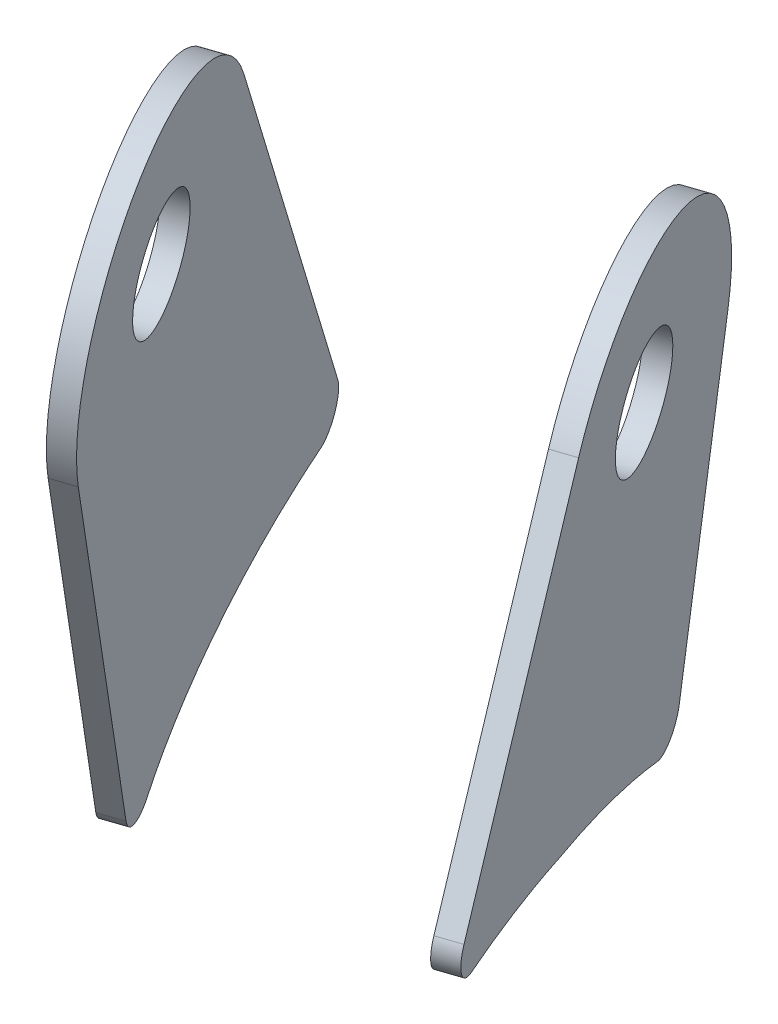
from build123d import *

# Parameters (mm, degrees)
SKETCH2_R            = 3.175
BASE_FLANGE1_DEPTH   = 1.27
BASE_FLANGE2_START   = -1.27
SKETCH3_R            = 3.175
BASE_FLANGE2_DEPTH   = 1.27
CUT_EXTRUDE1_START   = 1383.390590681
CUT_EXTRUDE1_DEPTH   = 21.59
CUT_EXTRUDE1_START_2 = 1403.710590681
CUT_EXTRUDE1_2_DEPTH = 1.27
FILLET1_R            = 1.5875
FILLET2_R            = 1.5875


# Read off the part's stored shape, not the designer's step: Cut-Extrude1
# Sheet-metal steps are written as plain solids
with BuildPart() as part:
    # Sketch2 → Base-Flange1 (new body)
    with BuildSketch(Plane(origin=(1271.017200109, -117.186128876, -584.111385454), x_dir=(-0.41343144837747287, 0.048074727094114526, -0.9092652297912482), z_dir=(0.9054695523042622, -0.08348311229805495, -0.4161195258708122))):
        with BuildLine():
            Line((-111.741539823, 304.685096578), (-142.590441512, 312.195606854))
            Line((-142.590441512, 312.195606854), (-125.683734865, 342.423547719))
            ThreePointArc((-125.683734865, 342.423547719), (-114.423324415, 346.831514257), (-107.913283545, 336.641009835))
            Line((-107.913283545, 336.641009835), (-111.741539823, 304.685096578))
        make_face()
        with Locations(Location((-117.791498951, 339.304688334, 0), (0, 0, 357.234798667))):
            Circle(SKETCH2_R, mode=Mode.SUBTRACT)
    extrude(amount=BASE_FLANGE1_DEPTH)


with BuildPart() as body_2:
    # Sketch3 → Base-Flange2 (new body)
    with BuildSketch(Plane(origin=(1253.768005138, -115.595775587, -576.184308486), x_dir=(-0.41343144837747287, 0.048074727094114526, -0.9092652297912482), z_dir=(0.9054695523042622, -0.08348311229805495, -0.4161195258708122)).offset(BASE_FLANGE2_START)):
        with BuildLine():
            Line((-114.826429992, 305.436147605), (-83.977528304, 297.925637329))
            Line((-83.977528304, 297.925637329), (-109.072885328, 342.450794137))
            ThreePointArc((-109.072885328, 342.450794137), (-121.469860523, 346.371786734), (-126.228340332, 334.271536867))
            Line((-126.228340332, 334.271536867), (-114.826429992, 305.436147605))
        make_face()
        with Locations(Location((-117.791498951, 339.304688334, 0), (0, 0, 357.234798667))):
            Circle(SKETCH3_R, mode=Mode.SUBTRACT)
    extrude(amount=BASE_FLANGE2_DEPTH)


with BuildPart() as cut_extrude1_tool:
    # Cut-Extrude1 outline → Cut-Extrude1 (new body)
    with BuildSketch(Plane(origin=(0, 0, 0), x_dir=(0.07585621579403598, 0.996509192110655, -0.034860644922007814), z_dir=(0.9054695523042622, -0.08348311229805501, -0.4161195258708122)).offset(CUT_EXTRUDE1_START)):
        with BuildLine():
            Line((301.620270259, 130.368525756), (313.659534542, 135.814514494))
            add(Edge.make_bspline(
                [(314.39563609, 139.451923084), (314.080178625, 137.620550007), (313.659534542, 135.814514494)],
                knots=[4.667621379, 4.667621379, 4.667621379, 4.798627184, 4.798627184, 4.798627184], degree=2, weights=[1, 0.991421278, 0.987108427]))
            add(Edge.make_bspline(
                [(315.765923985, 152.105599478), (315.778536243, 145.923297426), (314.39563609, 139.451923084)],
                knots=[4.300161202, 4.300161202, 4.300161202, 4.757156582, 4.757156582, 4.757156582], degree=2, weights=[1, 0.974007789, 1]))
            Line((315.765923985, 152.105599478), (304.953083323, 157.485707038))
            Line((304.953083323, 157.485707038), (299.540917585, 129.427925817))
            Line((299.540917585, 129.427925817), (293.527400097, 98.25261335))
            Line((293.527400097, 98.25261335), (307.840240712, 107.256042799))
            add(Edge.make_bspline(
                [(307.840240712, 107.256042799), (308.18810541, 111.397419869), (308.183888711, 115.675478714), (307.714650854, 119.739298085), (306.758436434, 123.198741783), (304.833094177, 127.168835045), (304.108187458, 128.292843046), (303.317163588, 129.197719216), (302.481286055, 129.885010912), (301.620270259, 130.368525756)],
                knots=[3.684656994, 3.684656994, 3.684656994, 3.684656994, 3.684656994, 3.684656994, 4.476569223, 4.476569223, 4.476569223, 4.476569223, 4.872364489, 4.872364489, 4.872364489, 4.872364489, 4.872364489, 4.872364489], degree=5, weights=[1, 1, 0.997972732, 0.997583217, 1, 1, 0.999902079, 0.999924912, 1, 1]))
        make_face()
    extrude(amount=CUT_EXTRUDE1_DEPTH)


with BuildPart() as part_1:
    add(part.part)

    # Cut-Extrude1: cut by cut_extrude1_tool
    add(cut_extrude1_tool.part, mode=Mode.SUBTRACT)

    # Cut-Extrude1 2 outline → Cut-Extrude1 2 (cut)
    with BuildSketch(Plane(origin=(0, 0, 0), x_dir=(0.07585621579403598, 0.996509192110655, -0.034860644922007814), z_dir=(0.9054695523042622, -0.08348311229805501, -0.4161195258708122)).offset(CUT_EXTRUDE1_START_2)):
        with BuildLine():
            Line((313.659534542, 135.814514494), (301.620270259, 130.368525756))
            add(Edge.make_bspline(
                [(301.620270259, 130.368525756), (303.903052509, 129.086599093), (305.474701099, 125.845829066)],
                knots=[3.288861728, 3.288861728, 3.288861728, 3.684656994, 3.684656994, 3.684656994], degree=2, weights=[1, 0.942945604, 0.92391717]))
            Line((305.474701099, 125.845829066), (310.2442301, 125.506775846))
            add(Edge.make_bspline(
                [(313.659534542, 135.814514494), (312.365699462, 130.259433149), (310.2442301, 125.506775846)],
                knots=[4.798627184, 4.798627184, 4.798627184, 5.194530174, 5.194530174, 5.194530174], degree=2, weights=[0.987108427, 0.974074877, 1]))
        make_face()
    extrude(amount=CUT_EXTRUDE1_2_DEPTH, mode=Mode.SUBTRACT)

    # Fillet1
    fillet1_edges = [part_1.edges().sort_by_distance(p)[0] for p in [
        (1359.060812848, 197.424505154, -457.173973401),
        (1347.534895545, 191.922086442, -481.150277132),
    ]]
    fillet(fillet1_edges, radius=FILLET1_R)


with BuildPart() as body_2_1:
    add(body_2.part)

    # Cut-Extrude1: cut by cut_extrude1_tool
    add(cut_extrude1_tool.part, mode=Mode.SUBTRACT)

    # Fillet2
    fillet2_edges = [body_2_1.edges().sort_by_distance(p)[0] for p in [
        (1321.33230656, 191.222865761, -489.194296195),
        (1330.511729235, 185.02460803, -467.976504101),
    ]]
    fillet(fillet2_edges, radius=FILLET2_R)


solid = Compound([part_1.part, body_2_1.part])
